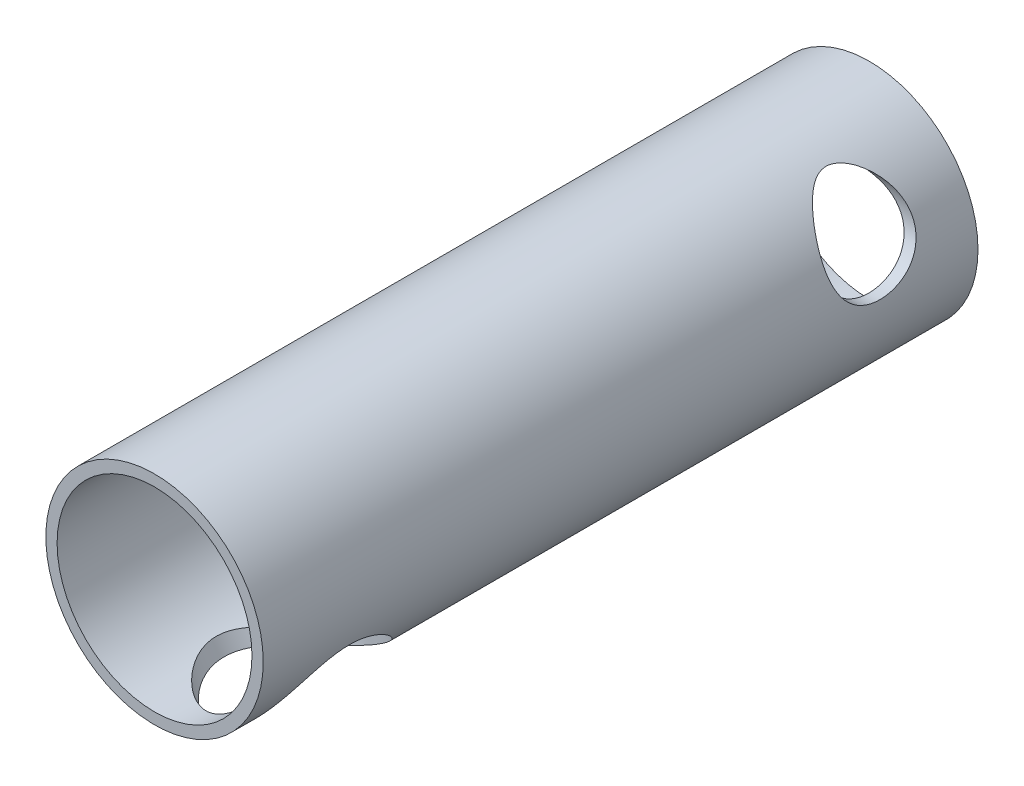
from build123d import *

# Parameters (mm, degrees)
BOSS_EXTRUDE1_DEPTH = 146.05
CUT_EXTRUDE2_REACH  = 157.431
SKETCH5_R           = 14.8463
CUT_EXTRUDE3_REACH  = 156.263
SKETCH4_R           = 9.0424


with BuildPart() as part:
    # Sketch1 → Boss-Extrude1 (new body)
    with BuildSketch(Plane.XY):
        with BuildLine():
            ThreePointArc((22.160563267, 0), (-0.505626758, 22.205314469), (-22.240696585, -0.91218757))
            ThreePointArc((-22.240696585, -0.91218757), (0.406753293, -22.205314469), (22.160563267, 0))
        make_face()
        with BuildLine():
            ThreePointArc((19.860563267, 0), (0.359511642, -19.905799688), (-19.942637258, -0.817724202))
            ThreePointArc((-19.942637258, -0.817724202), (-0.458385107, 19.905799688), (19.860563267, 0))
        make_face(mode=Mode.SUBTRACT)
    extrude(amount=BOSS_EXTRUDE1_DEPTH)

    # Sketch5 → Cut-Extrude2 (cut, up to next)
    with BuildSketch(Plane(origin=(11.092620184, -19.212981748, 146.05), x_dir=(-0.8650599616540103, -0.5016684789212517, 0), z_dir=(0.5016684789212515, -0.8650599616540102, 0)), mode=Mode.PRIVATE) as cut_extrude2_sk1:
        with Locations((-0.049436639, 18.7)):
            Circle(SKETCH5_R)
    cut_extrude2_tool1 = extrude(cut_extrude2_sk1.sketch, amount=-CUT_EXTRUDE2_REACH, mode=Mode.PRIVATE) & part.part
    add(cut_extrude2_tool1.solids().sort_by_distance((11.135386, -19.188181, 127.35))[0], mode=Mode.SUBTRACT)

    # Sketch4 → Cut-Extrude3 (cut, up to next)
    with BuildSketch(Plane(origin=(22.160563267, 0, 146.05), x_dir=(0, 0, -1), z_dir=(1, 0, 0)), mode=Mode.PRIVATE) as cut_extrude3_sk1:
        with Locations((126.05, 10.153466667)):
            Circle(SKETCH4_R)
    cut_extrude3_tool1 = extrude(cut_extrude3_sk1.sketch, amount=-CUT_EXTRUDE3_REACH, mode=Mode.PRIVATE) & part.part
    add(cut_extrude3_tool1.solids().sort_by_distance((22.160563, 10.153467, 20))[0], mode=Mode.SUBTRACT)


solid = part.part
